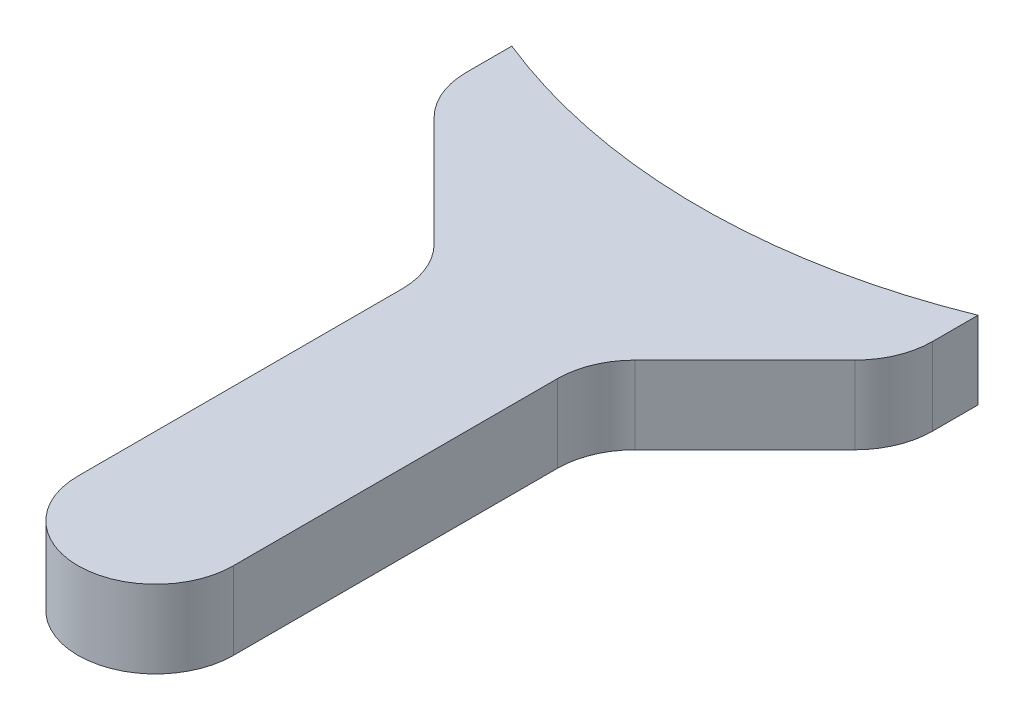
from build123d import *

# Parameters (mm, degrees)
BOSS_EXTRUDE1_DEPTH = 12.7
FILLET1_R           = 12.7


with BuildPart() as part:
    # Sketch1 → Boss-Extrude1 (new body)
    with BuildSketch(Plane(origin=(0, 0, 0), x_dir=(1, 0, 0), z_dir=(0, 1, 0))):
        with BuildLine():
            Line((0, -101.6), (0, -203.2))
            Line((0, -203.2), (12.7, -203.2))
            Line((12.7, -203.2), (12.7, -132.285720786))
            Line((12.7, -132.285720786), (38.1, -106.885720786))
            Line((38.1, -106.885720786), (38.1, -94.185720786))
            ThreePointArc((38.1, -94.185720786), (19.407353866, -99.729206434), (0, -101.6))
        make_face()
    extrude(amount=BOSS_EXTRUDE1_DEPTH)

    # Fillet1
    fillet1_edges = [part.edges().sort_by_distance(p)[0] for p in [
        (38.1, 6.35, 106.885720786),
        (12.7, 6.35, 132.285720786),
        (12.7, 6.35, 203.2),
    ]]
    fillet(fillet1_edges, radius=FILLET1_R - 0.0001)  # a hair under: the kernel refuses the full size

    # Mirror1: part across plane


with BuildPart() as part_1:
    add(part.part)
    add(part.part.mirror(Plane(origin=(0, 12.7, 101.6), x_dir=(0, 0, 1), z_dir=(1, 0, 0))))


solid = part_1.part
